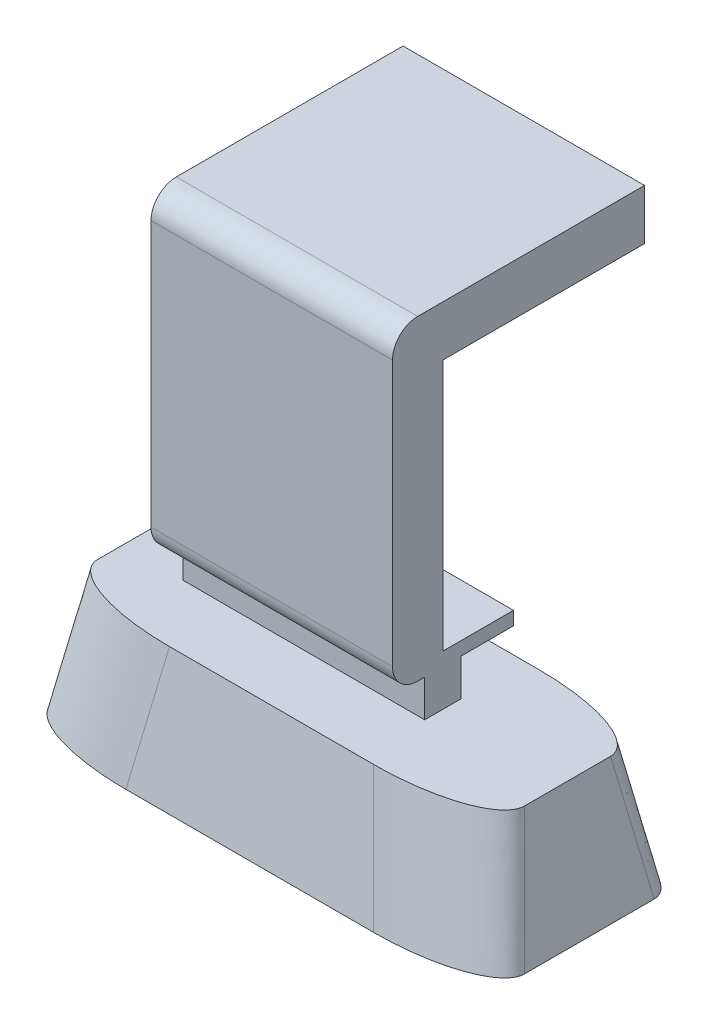
from build123d import *

# Parameters (mm, degrees)
SKETCH1_W           = 71.12
SKETCH1_H           = 31.5
BOSS_EXTRUDE1_DEPTH = 18.6944
BOSS_EXTRUDE1_TAPER = 10
SKETCH3_R           = 4
CUT_EXTRUDE1_DEPTH  = 2.54
CHAMFER1_SIZE       = 2.54
BOSS_EXTRUDE2_DEPTH = 6.55
BOSS_EXTRUDE3_START = 29.95
BOSS_EXTRUDE3_DEPTH = 29.95


# Some blends are built 0.0001 mm under size
with BuildPart() as part:
    # Sketch1 → Boss-Extrude1 (new body)
    with BuildSketch(Plane(origin=(0, 0, 0), x_dir=(1, 0, 0), z_dir=(0, 1, 0))):
        with Locations((16.51, 0)):
            Rectangle(SKETCH1_W, SKETCH1_H)
    extrude(amount=BOSS_EXTRUDE1_DEPTH, taper=BOSS_EXTRUDE1_TAPER)

    # Fillet1
    # an asymmetric fillet: 16.764, 6.35 mm, written as the material it takes off along each edge
    with BuildSketch(Plane(origin=(59.161619342, -40.218571846, 22.841619342), x_dir=(-0.985255774317392, -0.16848866057223846, 0.029709096802316298), z_dir=(-0.1710878697460354, 0.9702875252478138, -0.17108786974603588))) as fillet1_piece_1:
        with BuildLine():
            Bezier((16.580063455, 0), (0, 0), (-0.17631352, -5.844503547), weights=[1, 0.717688543, 1])
            Line((-0.17631352, -5.844503547), (0, 0))
            Line((0, 0), (16.580063455, 0))
        make_face()
    extrude(amount=102.167183553, mode=Mode.SUBTRACT)
    with BuildSketch(Plane(origin=(-26.141619342, -40.218571846, -22.841619342), x_dir=(-0.029709096802316662, -0.16848866057223877, 0.9852557743173919), z_dir=(0.1710878697460356, 0.9702875252478138, 0.1710878697460358))) as fillet1_piece_2:
        with BuildLine():
            Bezier((5.847162404, 0), (0, 0), (-0.499950087, 16.572524071), weights=[1, 0.717688543, 1])
            Line((-0.499950087, 16.572524071), (0, 0))
            Line((0, 0), (5.847162404, 0))
        make_face()
    extrude(amount=102.167183553, mode=Mode.SUBTRACT)
    with BuildSketch(Plane(origin=(59.161619342, -40.218571846, -22.841619342), x_dir=(0.029709096802316877, -0.16848866057223874, 0.9852557743173919), z_dir=(-0.1710878697460358, 0.9702875252478138, 0.1710878697460358)), Plane(origin=(-26.141619342, -40.218571846, 22.841619342), x_dir=(-0.029709096802316284, -0.16848866057223885, -0.9852557743173919), z_dir=(0.1710878697460356, 0.9702875252478138, -0.1710878697460358))) as fillet1_piece_3:
        with BuildLine():
            Bezier((5.847162404, 0), (0, 0), (-0.499950087, -16.572524071), weights=[1, 0.717688543, 1])
            Line((-0.499950087, -16.572524071), (0, 0))
            Line((0, 0), (5.847162404, 0))
        make_face()
    extrude(amount=102.167183553, mode=Mode.SUBTRACT)

    # Sketch3 → Cut-Extrude1 (cut)
    with BuildSketch(Plane.XZ):
        with Locations(Location((0, 0, 0), (0, 0, 270))):
            Circle(SKETCH3_R)
    extrude(amount=-CUT_EXTRUDE1_DEPTH, mode=Mode.SUBTRACT)

    # Chamfer1
    chamfer1_edges = [part.edges().sort_by_distance(p)[0] for p in [
        (0, 0, 4),
    ]]
    chamfer(chamfer1_edges, length=CHAMFER1_SIZE - 0.0001)  # a hair under: the kernel refuses the full size

    # Sketch4 → Boss-Extrude2 (add)
    with BuildSketch(Plane(origin=(0, 0, 0), x_dir=(0, 0, -1), z_dir=(1, 0, 0))):
        with BuildLine():
            Line((30.48, 64.4144), (30.48, 72.0344))
            Line((30.48, 72.0344), (-3.81, 72.0344))
            ThreePointArc((-3.81, 72.0344), (-6.504076836, 70.918476836), (-7.62, 68.2244))
            Line((-7.62, 68.2244), (-7.62, 64.4144))
            Line((-7.62, 64.4144), (-7.62, 28.0924))
            ThreePointArc((-7.62, 28.0924), (-6.504076836, 25.398323164), (-3.81, 24.2824))
            Line((-3.81, 24.2824), (-2.756322634, 24.2824))
            Line((-2.756322634, 24.2824), (-2.756322634, 18.6944))
            Line((-2.756322634, 18.6944), (2.756322634, 18.6944))
            Line((2.756322634, 18.6944), (2.756322634, 24.2824))
            Line((2.756322634, 24.2824), (10.668, 24.2824))
            Line((10.668, 24.2824), (10.668, 26.3144))
            Line((10.668, 26.3144), (0, 26.3144))
            Line((0, 26.3144), (0, 64.4144))
            Line((0, 64.4144), (30.48, 64.4144))
        make_face()
    extrude(amount=-BOSS_EXTRUDE2_DEPTH)

    # Sketch5 → Boss-Extrude3 (add)
    with BuildSketch(Plane(origin=(0, 0, 0), x_dir=(0, 0, -1), z_dir=(1, 0, 0)).offset(BOSS_EXTRUDE3_START)):
        with BuildLine():
            Line((-7.62, 68.2244), (-7.62, 28.0924))
            ThreePointArc((-7.62, 28.0924), (-6.504076836, 25.398323164), (-3.81, 24.2824))
            Line((-3.81, 24.2824), (-2.756322634, 24.2824))
            Line((-2.756322634, 24.2824), (-2.756322634, 18.6944))
            Line((-2.756322634, 18.6944), (2.756322634, 18.6944))
            Line((2.756322634, 18.6944), (2.756322634, 24.2824))
            Line((2.756322634, 24.2824), (10.668, 24.2824))
            Line((10.668, 24.2824), (10.668, 26.3144))
            Line((10.668, 26.3144), (0, 26.3144))
            Line((0, 26.3144), (0, 64.4144))
            Line((0, 64.4144), (30.48, 64.4144))
            Line((30.48, 64.4144), (30.48, 72.0344))
            Line((30.48, 72.0344), (-3.81, 72.0344))
            ThreePointArc((-3.81, 72.0344), (-6.504076836, 70.918476836), (-7.62, 68.2244))
        make_face()
    extrude(amount=-BOSS_EXTRUDE3_DEPTH)


solid = part.part
